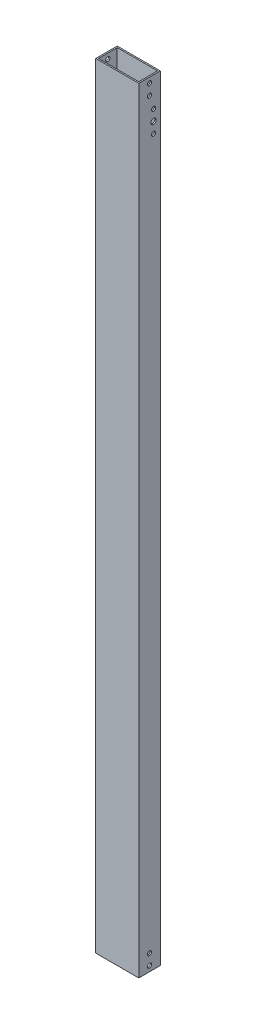
from build123d import *

# Parameters (mm, degrees)
SKETCH1_W               = 50.8
SKETCH1_H               = 914.4
BOSS_EXTRUDE1_DEPTH     = 12.7
SHELL1_T                = -1.5875
SKETCH3_R               = 2.4892
CUT_EXTRUDE1_DEPTH      = 459.081095441
CUT_EXTRUDE2_DEPTH      = 459.081095441
CUT_EXTRUDE2_DEPTH_BACK = 459.081095441
SKETCH4_R               = 3.175
SKETCH4_R_2             = 2.4892
SKETCH5_W               = 31.75
SKETCH5_H               = 26.9875
CUT_EXTRUDE3_DEPTH      = 459.081095441
FILLET1_R               = 3.175


with BuildPart() as part:
    # Sketch1 → Boss-Extrude1 (new, symmetric)
    with BuildSketch(Plane.XY):
        Rectangle(SKETCH1_W, SKETCH1_H)
    extrude(amount=BOSS_EXTRUDE1_DEPTH, both=True)

    # Shell1
    shell1_openings = [part.faces().sort_by_distance(p)[0] for p in [
        (0, -457.2, 0),
        (0, 457.2, 0),
    ]]
    offset(amount=SHELL1_T, openings=shell1_openings, kind=Kind.INTERSECTION)

    # Sketch3 → Cut-Extrude1 (cut, symmetric)
    with BuildSketch(Plane(origin=(0, 0, 0), x_dir=(0, 0, -1), z_dir=(1, 0, 0))):
        with Locations((0, -450.85)):
            Circle(SKETCH3_R)
        with Locations((0, -438.15)):
            Circle(SKETCH3_R)
    cut_extrude1 = extrude(amount=CUT_EXTRUDE1_DEPTH, both=True, mode=Mode.SUBTRACT)

    # Sketch4 → Cut-Extrude2 (cut, two sides: drawn at the far end of the back side and taken through both)
    with BuildSketch(Plane(origin=(0, 0, 0), x_dir=(0, 0, -1), z_dir=(1, 0, 0)).offset(-CUT_EXTRUDE2_DEPTH_BACK)):
        with Locations((4.7625, 409.575)):
            Circle(SKETCH4_R)
        with Locations((4.7625, 422.275)):
            Circle(SKETCH4_R_2)
        with Locations((4.7625, 396.875)):
            Circle(SKETCH4_R_2)
    extrude(amount=CUT_EXTRUDE2_DEPTH + CUT_EXTRUDE2_DEPTH_BACK, mode=Mode.SUBTRACT)

    # Mirror1: Cut-Extrude1 across plane
    add(cut_extrude1.mirror(Plane.ZX), mode=Mode.SUBTRACT)

    # Sketch5 → Cut-Extrude3 (cut, through all)
    with BuildSketch(Plane.XY):
        with Locations((0, 409.575)):
            Rectangle(SKETCH5_W, SKETCH5_H)
    extrude(amount=-CUT_EXTRUDE3_DEPTH, mode=Mode.SUBTRACT)

    # Fillet1
    fillet1_edges = [part.edges().sort_by_distance(p)[0] for p in [
        (15.875, 423.06875, -11.90625),
        (15.875, 396.08125, -11.90625),
        (-15.875, 396.08125, -11.90625),
        (-15.875, 423.06875, -11.90625),
    ]]
    fillet(fillet1_edges, radius=FILLET1_R)


solid = part.part
